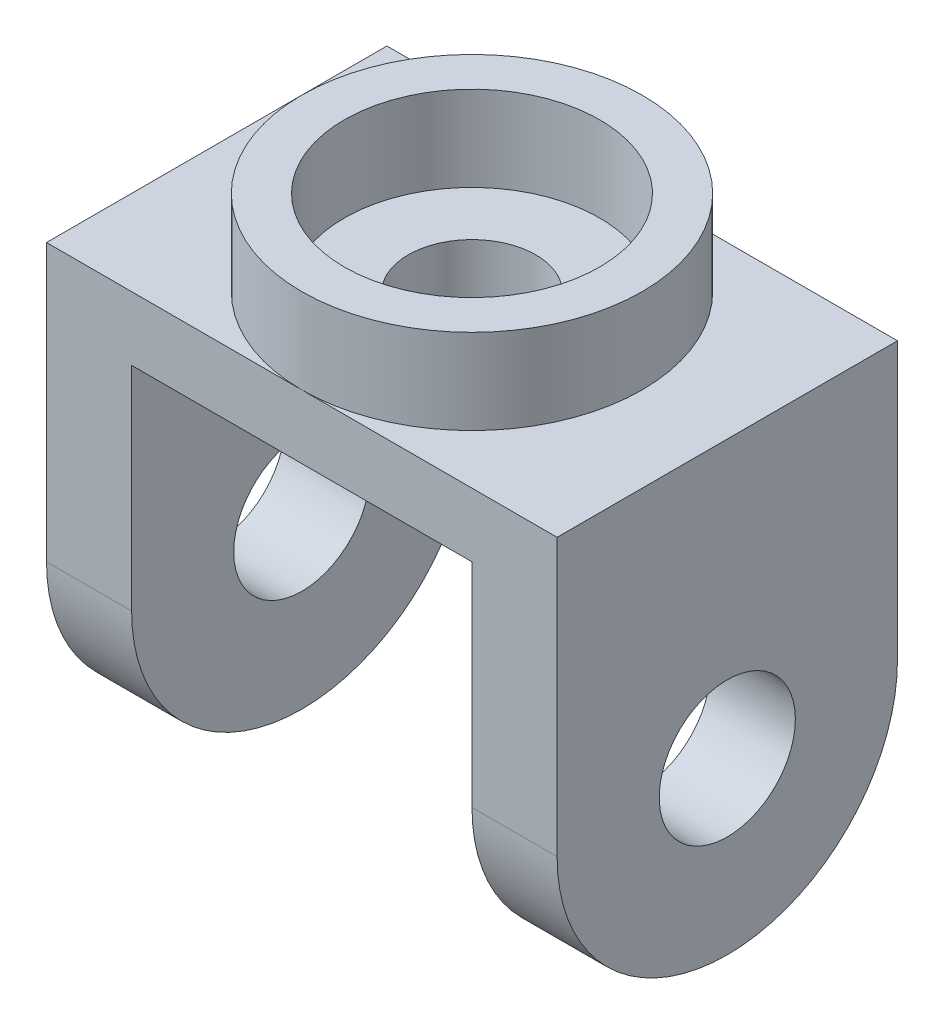
from build123d import *

# Parameters (mm, degrees)
SKETCH2_W           = 120000
SKETCH2_H           = 80000
BOSS_EXTRUDE1_DEPTH = 15000
SKETCH3_R           = 40000
SKETCH3_R_2         = 30000
BOSS_EXTRUDE2_DEPTH = 20000
SKETCH4_R           = 15000
CUT_EXTRUDE1_DEPTH  = 20000
SKETCH7_W           = 80000
SKETCH7_H           = 50000
BOSS_EXTRUDE4_DEPTH = 20000
BOSS_EXTRUDE5_DEPTH = 20000
SKETCH11_R          = 16000
CUT_EXTRUDE3_DEPTH  = 20499.960430488
BOSS_EXTRUDE7_START = -20000
BOSS_EXTRUDE7_DEPTH = 20000
CUT_EXTRUDE4_START  = -20000
SKETCH15_R          = 16000
CUT_EXTRUDE4_DEPTH  = 20000


with BuildPart() as part:
    # Sketch2 → Boss-Extrude1 (new body)
    with BuildSketch(Plane(origin=(0, 0, 0), x_dir=(1, 0, 0), z_dir=(0, 1, 0))):
        Rectangle(SKETCH2_W, SKETCH2_H)
    extrude(amount=BOSS_EXTRUDE1_DEPTH)

    # Sketch3 → Boss-Extrude2 (add)
    with BuildSketch(Plane(origin=(0, 15000, 0), x_dir=(1, 0, 0), z_dir=(0, 1, 0))):
        Circle(SKETCH3_R)
        Circle(SKETCH3_R_2, mode=Mode.SUBTRACT)
    extrude(amount=BOSS_EXTRUDE2_DEPTH)

    # Sketch4 → Cut-Extrude1 (cut)
    with BuildSketch(Plane(origin=(0, 15000, 0), x_dir=(1, 0, 0), z_dir=(0, 1, 0))):
        Circle(SKETCH4_R)
    extrude(amount=-CUT_EXTRUDE1_DEPTH, mode=Mode.SUBTRACT)

    # Sketch7 → Boss-Extrude4 (add)
    with BuildSketch(Plane.ZY.offset(60000)):
        with Locations((0, -25000)):
            Rectangle(SKETCH7_W, SKETCH7_H)
    extrude(amount=-BOSS_EXTRUDE4_DEPTH)

    # Sketch9 → Boss-Extrude5 (add)
    with BuildSketch(Plane.ZY.offset(60000)):
        with BuildLine():
            Line((-40000, -50000), (40000, -50000))
            ThreePointArc((40000, -50000), (0, -90000), (-40000, -50000))
        make_face()
    extrude(amount=-BOSS_EXTRUDE5_DEPTH)

    # Sketch11 → Cut-Extrude3 (cut)
    with BuildSketch(Plane.ZY.offset(60000)):
        with Locations((0, -50000)):
            Circle(SKETCH11_R)
    extrude(amount=-CUT_EXTRUDE3_DEPTH, mode=Mode.SUBTRACT)

    # Sketch14 → Boss-Extrude7 (add)
    with BuildSketch(Plane(origin=(60000, 0, 0), x_dir=(0, 0, -1), z_dir=(1, 0, 0)).offset(BOSS_EXTRUDE7_START)):
        with BuildLine():
            Line((-40000, 0), (40000, 0))
            Line((40000, 0), (40000, -50000))
            ThreePointArc((40000, -50000), (0, -90000), (-40000, -50000))
            Line((-40000, -50000), (-40000, 0))
        make_face()
    extrude(amount=BOSS_EXTRUDE7_DEPTH)

    # Sketch15 → Cut-Extrude4 (cut)
    with BuildSketch(Plane(origin=(60000, 0, 0), x_dir=(0, 0, -1), z_dir=(1, 0, 0)).offset(CUT_EXTRUDE4_START)):
        with Locations((0, -50000)):
            Circle(SKETCH15_R)
    extrude(amount=CUT_EXTRUDE4_DEPTH, mode=Mode.SUBTRACT)


solid = part.part
